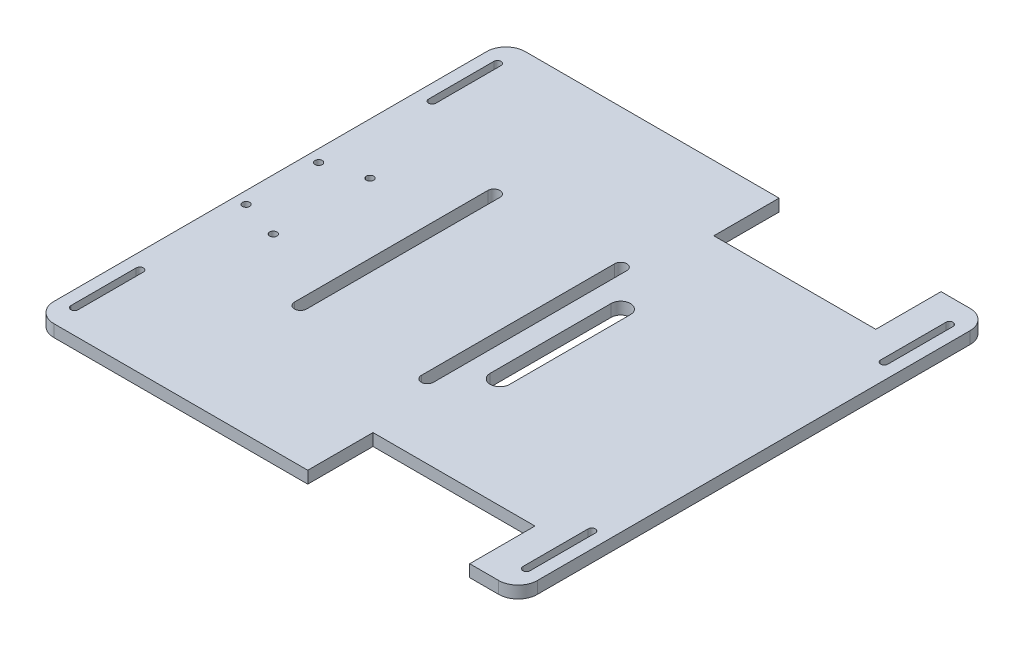
from build123d import *

# Parameters (mm, degrees)
SKETCH2_W           = 200
SKETCH2_H           = 195
BOSS_EXTRUDE1_DEPTH = 5
CUT_EXTRUDE1_DEPTH  = 140.754248594
SKETCH4_W           = 67
SKETCH4_H           = 27
CUT_EXTRUDE2_DEPTH  = 140.754248594
SKETCH8_R           = 1.5
CUT_EXTRUDE6_DEPTH  = 140.754248594
SKETCH9_R           = 1.5
CUT_EXTRUDE7_DEPTH  = 140.754248594
FILLET1_R           = 8


with BuildPart() as part:
    # Sketch2 → Boss-Extrude1 (new body)
    with BuildSketch(Plane(origin=(0, 0, 0), x_dir=(1, 0, 0), z_dir=(0, 1, 0))):
        Rectangle(SKETCH2_W, SKETCH2_H)
    extrude(amount=BOSS_EXTRUDE1_DEPTH)

    # Sketch3 → Cut-Extrude1 (cut, through all)
    with BuildSketch(Plane(origin=(0, 5, 0), x_dir=(1, 0, 0), z_dir=(0, 1, 0))):
        with BuildLine():
            Line((-95, -87.5), (-95, -60.5))
            ThreePointArc((-95, -60.5), (-93.5, -59), (-92, -60.5))
            Line((-92, -60.5), (-92, -87.5))
            ThreePointArc((-92, -87.5), (-93.5, -89), (-95, -87.5))
        make_face()
        with BuildLine():
            Line((-95, 87.5), (-95, 60.5))
            ThreePointArc((-95, 60.5), (-93.5, 59), (-92, 60.5))
            Line((-92, 60.5), (-92, 87.5))
            ThreePointArc((-92, 87.5), (-93.5, 89), (-95, 87.5))
        make_face()
        with BuildLine():
            Line((95, 87.5), (95, 60.5))
            ThreePointArc((95, 60.5), (93.5, 59), (92, 60.5))
            Line((92, 60.5), (92, 87.5))
            ThreePointArc((92, 87.5), (93.5, 89), (95, 87.5))
        make_face()
        with BuildLine():
            Line((95, -87.5), (95, -60.5))
            ThreePointArc((95, -60.5), (93.5, -59), (92, -60.5))
            Line((92, -60.5), (92, -87.5))
            ThreePointArc((92, -87.5), (93.5, -89), (95, -87.5))
        make_face()
    extrude(amount=-CUT_EXTRUDE1_DEPTH, mode=Mode.SUBTRACT)

    # Sketch4 → Cut-Extrude2 (cut, through all)
    with BuildSketch(Plane.XZ):
        with Locations((46.5, -84)):
            Rectangle(SKETCH4_W, SKETCH4_H)
        with Locations((46.5, 84)):
            Rectangle(SKETCH4_W, SKETCH4_H)
        with BuildLine():
            Line((-45, 40), (-45, -40))
            ThreePointArc((-45, -40), (-47.5, -42.5), (-50, -40))
            Line((-50, -40), (-50, 40))
            ThreePointArc((-50, 40), (-47.5, 42.5), (-45, 40))
        make_face()
        with BuildLine():
            Line((24, 25), (24, -25))
            ThreePointArc((24, -25), (20, -29), (16, -25))
            Line((16, -25), (16, 25))
            ThreePointArc((16, 25), (20, 29), (24, 25))
        make_face()
        with BuildLine():
            Line((7.5, 40), (7.5, -40))
            ThreePointArc((7.5, -40), (5, -42.5), (2.5, -40))
            Line((2.5, -40), (2.5, 40))
            ThreePointArc((2.5, 40), (5, 42.5), (7.5, 40))
        make_face()
    extrude(amount=-CUT_EXTRUDE2_DEPTH, mode=Mode.SUBTRACT)

    # Sketch8 → Cut-Extrude6 (cut, through all)
    with BuildSketch(Plane(origin=(0, 5, 0), x_dir=(1, 0, 0), z_dir=(0, 1, 0))):
        with Locations((-78.75, -19.995)):
            Circle(SKETCH8_R)
        with Locations((-78.75, 19.995)):
            Circle(SKETCH8_R)
    extrude(amount=-CUT_EXTRUDE6_DEPTH, mode=Mode.SUBTRACT)

    # Sketch9 → Cut-Extrude7 (cut, through all)
    with BuildSketch(Plane(origin=(0, 5, 0), x_dir=(1, 0, 0), z_dir=(0, 1, 0))):
        with Locations((-95, 15)):
            Circle(SKETCH9_R)
        with Locations((-95, -15)):
            Circle(SKETCH9_R)
    extrude(amount=-CUT_EXTRUDE7_DEPTH, mode=Mode.SUBTRACT)

    # Fillet1
    fillet1_edges = [part.edges().sort_by_distance(p)[0] for p in [
        (100, 2.5, -97.5),
        (100, 2.5, 97.5),
        (-100, 2.5, -97.5),
        (-100, 2.5, 97.5),
    ]]
    fillet(fillet1_edges, radius=FILLET1_R)


solid = part.part
